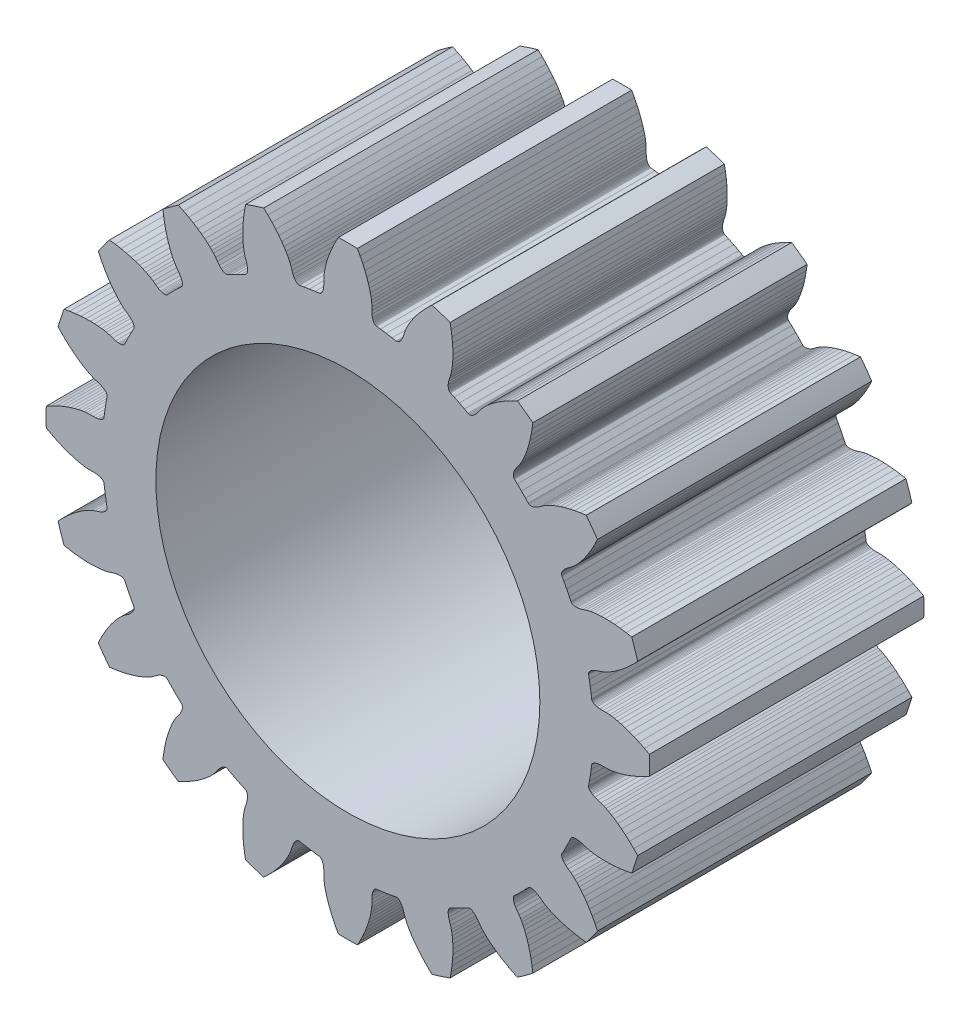
from build123d import *

# Parameters (mm, degrees)
MODEL_R             = 7
BOSS_EXTRUDE1_DEPTH = 10


with BuildPart() as part:
    # Model → Boss-Extrude1 (new body)
    with BuildSketch(Plane.XY):
        with BuildLine():
            Line((10.2642316, 2.7645963), (10.4198698, 2.9157647))
            Line((10.4198698, 2.9157647), (10.563702333, 3.067222802))
            ThreePointArc((10.563702333, 3.067222802), (10.461607226, 3.399182266), (10.349083027, 3.727753112))
            Line((10.349083027, 3.727753112), (10.1436952, 3.7657426))
            Line((10.1436952, 3.7657426), (9.9289267, 3.7965585))
            Line((9.9289267, 3.7965585), (9.7306982, 3.8165653))
            Line((9.7306982, 3.8165653), (9.5477946, 3.8273548))
            Line((9.5477946, 3.8273548), (9.3796606, 3.8301929))
            Line((9.3796606, 3.8301929), (9.2296358, 3.8264332))
            Line((9.2296358, 3.8264332), (9.0951517, 3.8174159))
            Line((9.0951517, 3.8174159), (8.9794383, 3.8047754))
            Line((8.9794383, 3.8047754), (8.8801295, 3.7897415))
            Line((8.8801295, 3.7897415), (8.7979029, 3.7737819))
            Line((8.7979029, 3.7737819), (8.6805247, 3.7436154))
            Line((8.6805247, 3.7436154), (8.5689891, 3.7043833))
            Line((8.5689891, 3.7043833), (8.461599, 3.6746146))
            Line((8.461599, 3.6746146), (8.3671904, 3.6597655))
            Line((8.3671904, 3.6597655), (8.3251901, 3.6575683))
            Line((8.3251901, 3.6575683), (8.2868098, 3.6586634))
            Line((8.2868098, 3.6586634), (8.2521847, 3.6628951))
            Line((8.2521847, 3.6628951), (8.2214235, 3.6700945))
            Line((8.2214235, 3.6700945), (8.1946211, 3.6801191))
            Line((8.1946211, 3.6801191), (8.1718908, 3.6927909))
            Line((8.1718908, 3.6927909), (8.1533277, 3.7079451))
            Line((8.1533277, 3.7079451), (8.1390269, 3.725417))
            Line((8.1390269, 3.725417), (8.1311438, 3.7399412))
            Line((8.1311438, 3.7399412), (8.0678585, 3.8746306))
            Line((8.0678585, 3.8746306), (7.9745084, 4.063215))
            Line((7.9745084, 4.063215), (7.8768102, 4.2495839))
            Line((7.8768102, 4.2495839), (7.8050425, 4.3799512))
            Line((7.8050425, 4.3799512), (7.7979257, 4.3948659))
            Line((7.7979257, 4.3948659), (7.7921964, 4.4167052))
            Line((7.7921964, 4.4167052), (7.7908475, 4.4406305))
            Line((7.7908475, 4.4406305), (7.7939563, 4.466468))
            Line((7.7939563, 4.466468), (7.8016003, 4.4940439))
            Line((7.8016003, 4.4940439), (7.8138569, 4.5231619))
            Line((7.8138569, 4.5231619), (7.8307854, 4.5536616))
            Line((7.8307854, 4.5536616), (7.8524589, 4.5853556))
            Line((7.8524589, 4.5853556), (7.8789236, 4.618043))
            Line((7.8789236, 4.618043), (7.9464287, 4.6856931))
            Line((7.9464287, 4.6856931), (8.0336344, 4.755076))
            Line((8.0336344, 4.755076), (8.1309329, 4.8222501))
            Line((8.1309329, 4.8222501), (8.2243313, 4.8994796))
            Line((8.2243313, 4.8994796), (8.2855745, 4.9566215))
            Line((8.2855745, 4.9566215), (8.3561094, 5.0281273))
            Line((8.3561094, 5.0281273), (8.4343503, 5.1143115))
            Line((8.4343503, 5.1143115), (8.5206933, 5.2178112))
            Line((8.5206933, 5.2178112), (8.6119173, 5.336974))
            Line((8.6119173, 5.336974), (8.7084479, 5.4746654))
            Line((8.7084479, 5.4746654), (8.8072271, 5.6289795))
            Line((8.8072271, 5.6289795), (8.9075571, 5.8011094))
            Line((8.9075571, 5.8011094), (9.0088642, 5.9929738))
            Line((9.0088642, 5.9929738), (9.098854025, 6.181465815))
            ThreePointArc((9.098854025, 6.181465815), (8.899174807, 6.465628975), (8.690623821, 6.743346417))
            Line((8.690623821, 6.743346417), (8.483549, 6.7160083))
            Line((8.483549, 6.7160083), (8.2697694, 6.6789488))
            Line((8.2697694, 6.6789488), (8.0750604, 6.6367204))
            Line((8.0750604, 6.6367204), (7.8977746, 6.5904615))
            Line((7.8977746, 6.5904615), (7.7369927, 6.5412044))
            Line((7.7369927, 6.5412044), (7.5954723, 6.4912685))
            Line((7.5954723, 6.4912685), (7.4703569, 6.4411347))
            Line((7.4703569, 6.4411347), (7.3642131, 6.3933555))
            Line((7.3642131, 6.3933555), (7.2744105, 6.3483693))
            Line((7.2744105, 6.3483693), (7.2011401, 6.3077814))
            Line((7.2011401, 6.3077814), (7.0988288, 6.2428195))
            Line((7.0988288, 6.2428195), (7.0048755, 6.1710411))
            Line((7.0048755, 6.1710411), (6.9119405, 6.109544))
            Line((6.9119405, 6.109544), (6.8267412, 6.0662479))
            Line((6.8267412, 6.0662479), (6.7874756, 6.0511794))
            Line((6.7874756, 6.0511794), (6.7506353, 6.0403607))
            Line((6.7506353, 6.0403607), (6.7163972, 6.0336856))
            Line((6.7163972, 6.0336856), (6.6849168, 6.0310269))
            Line((6.6849168, 6.0310269), (6.6563285, 6.0322785))
            Line((6.6563285, 6.0322785), (6.6307948, 6.037306))
            Line((6.6307948, 6.037306), (6.6084573, 6.0459822))
            Line((6.6084573, 6.0459822), (6.5894574, 6.0581798))
            Line((6.5894574, 6.0581798), (6.5774719, 6.0695571))
            Line((6.5774719, 6.0695571), (6.4756627, 6.178098))
            Line((6.4756627, 6.178098), (6.3286057, 6.3286057))
            Line((6.3286057, 6.3286057), (6.178098, 6.4756627))
            Line((6.178098, 6.4756627), (6.0695571, 6.5774719))
            Line((6.0695571, 6.5774719), (6.0581798, 6.5894574))
            Line((6.0581798, 6.5894574), (6.0459822, 6.6084573))
            Line((6.0459822, 6.6084573), (6.037306, 6.6307948))
            Line((6.037306, 6.6307948), (6.0322785, 6.6563285))
            Line((6.0322785, 6.6563285), (6.0310269, 6.6849168))
            Line((6.0310269, 6.6849168), (6.0336856, 6.7163972))
            Line((6.0336856, 6.7163972), (6.0403607, 6.7506353))
            Line((6.0403607, 6.7506353), (6.0511794, 6.7874756))
            Line((6.0511794, 6.7874756), (6.0662479, 6.8267412))
            Line((6.0662479, 6.8267412), (6.109544, 6.9119405))
            Line((6.109544, 6.9119405), (6.1710411, 7.0048755))
            Line((6.1710411, 7.0048755), (6.2428195, 7.0988288))
            Line((6.2428195, 7.0988288), (6.3077814, 7.2011401))
            Line((6.3077814, 7.2011401), (6.3483693, 7.2744105))
            Line((6.3483693, 7.2744105), (6.3933555, 7.3642131))
            Line((6.3933555, 7.3642131), (6.4411347, 7.4703569))
            Line((6.4411347, 7.4703569), (6.4912685, 7.5954723))
            Line((6.4912685, 7.5954723), (6.5412044, 7.7369927))
            Line((6.5412044, 7.7369927), (6.5904615, 7.8977746))
            Line((6.5904615, 7.8977746), (6.6367204, 8.0750604))
            Line((6.6367204, 8.0750604), (6.6789488, 8.2697694))
            Line((6.6789488, 8.2697694), (6.7160083, 8.483549))
            Line((6.7160083, 8.483549), (6.743346317, 8.690623821))
            ThreePointArc((6.743346317, 8.690623821), (6.465628515, 8.899174311), (6.181465715, 9.098854025))
            Line((6.181465715, 9.098854025), (5.9929738, 9.0088642))
            Line((5.9929738, 9.0088642), (5.8011094, 8.9075571))
            Line((5.8011094, 8.9075571), (5.6289795, 8.8072271))
            Line((5.6289795, 8.8072271), (5.4746654, 8.7084479))
            Line((5.4746654, 8.7084479), (5.336974, 8.6119173))
            Line((5.336974, 8.6119173), (5.2178112, 8.5206933))
            Line((5.2178112, 8.5206933), (5.1143115, 8.4343503))
            Line((5.1143115, 8.4343503), (5.0281273, 8.3561094))
            Line((5.0281273, 8.3561094), (4.9566215, 8.2855745))
            Line((4.9566215, 8.2855745), (4.8994796, 8.2243313))
            Line((4.8994796, 8.2243313), (4.8222501, 8.1309329))
            Line((4.8222501, 8.1309329), (4.755076, 8.0336344))
            Line((4.755076, 8.0336344), (4.6856931, 7.9464287))
            Line((4.6856931, 7.9464287), (4.618043, 7.8789236))
            Line((4.618043, 7.8789236), (4.5853556, 7.8524589))
            Line((4.5853556, 7.8524589), (4.5536616, 7.8307854))
            Line((4.5536616, 7.8307854), (4.5231619, 7.8138569))
            Line((4.5231619, 7.8138569), (4.4940439, 7.8016003))
            Line((4.4940439, 7.8016003), (4.466468, 7.7939563))
            Line((4.466468, 7.7939563), (4.4406305, 7.7908475))
            Line((4.4406305, 7.7908475), (4.4167052, 7.7921964))
            Line((4.4167052, 7.7921964), (4.3948659, 7.7979257))
            Line((4.3948659, 7.7979257), (4.3799512, 7.8050425))
            Line((4.3799512, 7.8050425), (4.2495839, 7.8768102))
            Line((4.2495839, 7.8768102), (4.063215, 7.9745084))
            Line((4.063215, 7.9745084), (3.8746306, 8.0678585))
            Line((3.8746306, 8.0678585), (3.7399412, 8.1311438))
            Line((3.7399412, 8.1311438), (3.725417, 8.1390269))
            Line((3.725417, 8.1390269), (3.7079451, 8.1533277))
            Line((3.7079451, 8.1533277), (3.6927909, 8.1718908))
            Line((3.6927909, 8.1718908), (3.6801191, 8.1946211))
            Line((3.6801191, 8.1946211), (3.6700945, 8.2214235))
            Line((3.6700945, 8.2214235), (3.6628951, 8.2521847))
            Line((3.6628951, 8.2521847), (3.6586634, 8.2868098))
            Line((3.6586634, 8.2868098), (3.6575683, 8.3251901))
            Line((3.6575683, 8.3251901), (3.6597655, 8.3671904))
            Line((3.6597655, 8.3671904), (3.6746146, 8.461599))
            Line((3.6746146, 8.461599), (3.7043833, 8.5689891))
            Line((3.7043833, 8.5689891), (3.7436154, 8.6805247))
            Line((3.7436154, 8.6805247), (3.7737819, 8.7979029))
            Line((3.7737819, 8.7979029), (3.7897415, 8.8801295))
            Line((3.7897415, 8.8801295), (3.8047754, 8.9794383))
            Line((3.8047754, 8.9794383), (3.8174159, 9.0951517))
            Line((3.8174159, 9.0951517), (3.8264332, 9.2296358))
            Line((3.8264332, 9.2296358), (3.8301929, 9.3796606))
            Line((3.8301929, 9.3796606), (3.8273548, 9.5477946))
            Line((3.8273548, 9.5477946), (3.8165653, 9.7306982))
            Line((3.8165653, 9.7306982), (3.7965585, 9.9289267))
            Line((3.7965585, 9.9289267), (3.7657426, 10.1436952))
            Line((3.7657426, 10.1436952), (3.727753086, 10.349082973))
            ThreePointArc((3.727753086, 10.349082973), (3.399182156, 10.461606884), (3.067222791, 10.563702266))
            Line((3.067222791, 10.563702266), (2.9157647, 10.4198698))
            Line((2.9157647, 10.4198698), (2.7645963, 10.2642316))
            Line((2.7645963, 10.2642316), (2.6318948, 10.115621))
            Line((2.6318948, 10.115621), (2.5156578, 9.9739908))
            Line((2.5156578, 9.9739908), (2.4145351, 9.8396357))
            Line((2.4145351, 9.8396357), (2.3293943, 9.7160532))
            Line((2.3293943, 9.7160532), (2.2576417, 9.601953))
            Line((2.2576417, 9.601953), (2.1998535, 9.5009091))
            Line((2.1998535, 9.5009091), (2.1536439, 9.4117299))
            Line((2.1536439, 9.4117299), (2.1182238, 9.3358263))
            Line((2.1182238, 9.3358263), (2.0736359, 9.223134))
            Line((2.0736359, 9.223134), (2.0398164, 9.1098397))
            Line((2.0398164, 9.1098397), (2.0007775, 9.0054616))
            Line((2.0007775, 9.0054616), (1.9572986, 8.9203554))
            Line((1.9572986, 8.9203554), (1.9343891, 8.885085))
            Line((1.9343891, 8.885085), (1.9109438, 8.8546783))
            Line((1.9109438, 8.8546783), (1.8871681, 8.8291534))
            Line((1.8871681, 8.8291534), (1.8632626, 8.8084987))
            Line((1.8632626, 8.8084987), (1.8393985, 8.7927075))
            Line((1.8393985, 8.7927075), (1.8157863, 8.7817666))
            Line((1.8157863, 8.7817666), (1.7926151, 8.7756561))
            Line((1.7926151, 8.7756561), (1.7700743, 8.7743563))
            Line((1.7700743, 8.7743563), (1.7536904, 8.7765159))
            Line((1.7536904, 8.7765159), (1.6075263, 8.8044853))
            Line((1.6075263, 8.8044853), (1.4000885, 8.8398106))
            Line((1.4000885, 8.8398106), (1.1918873, 8.8703161))
            Line((1.1918873, 8.8703161), (1.0442339, 8.8888827))
            Line((1.0442339, 8.8888827), (1.0279845, 8.8918917))
            Line((1.0279845, 8.8918917), (1.0069486, 8.9000935))
            Line((1.0069486, 8.9000935), (0.9867997, 8.9130651))
            Line((0.9867997, 8.9130651), (0.9677241, 8.9307672))
            Line((0.9677241, 8.9307672), (0.9499077, 8.9531599))
            Line((0.9499077, 8.9531599), (0.933555, 8.9801909))
            Line((0.933555, 8.9801909), (0.9188306, 9.0118136))
            Line((0.9188306, 9.0118136), (0.9059289, 9.0479771))
            Line((0.9059289, 9.0479771), (0.8950398, 9.0886007))
            Line((0.8950398, 9.0886007), (0.8799882, 9.1829772))
            Line((0.8799882, 9.1829772), (0.8751146, 9.2943103))
            Line((0.8751146, 9.2943103), (0.8779602, 9.4125104))
            Line((0.8779602, 9.4125104), (0.8703784, 9.5334656))
            Line((0.8703784, 9.5334656), (0.8601475, 9.6165996))
            Line((0.8601475, 9.6165996), (0.8437574, 9.7156936))
            Line((0.8437574, 9.7156936), (0.8200218, 9.8296496))
            Line((0.8200218, 9.8296496), (0.7870399, 9.9603381))
            Line((0.7870399, 9.9603381), (0.7442553, 10.1041821))
            Line((0.7442553, 10.1041821), (0.6895999, 10.26321))
            Line((0.6895999, 10.26321), (0.6228181, 10.4338275))
            Line((0.6228181, 10.4338275), (0.5425346, 10.6161716))
            Line((0.5425346, 10.6161716), (0.4468599, 10.8109059))
            Line((0.4468599, 10.8109059), (0.347261396, 10.994501951))
            ThreePointArc((0.347261396, 10.994501951), (4.2e-08, 10.9999847), (-0.347261311, 10.994501948))
            Line((-0.347261311, 10.994501948), (-0.4468599, 10.8109059))
            Line((-0.4468599, 10.8109059), (-0.5425346, 10.6161716))
            Line((-0.5425346, 10.6161716), (-0.6228181, 10.4338275))
            Line((-0.6228181, 10.4338275), (-0.6895999, 10.26321))
            Line((-0.6895999, 10.26321), (-0.7442553, 10.1041821))
            Line((-0.7442553, 10.1041821), (-0.7870399, 9.9603381))
            Line((-0.7870399, 9.9603381), (-0.8200218, 9.8296496))
            Line((-0.8200218, 9.8296496), (-0.8437574, 9.7156936))
            Line((-0.8437574, 9.7156936), (-0.8601475, 9.6165996))
            Line((-0.8601475, 9.6165996), (-0.8703784, 9.5334656))
            Line((-0.8703784, 9.5334656), (-0.8779602, 9.4125104))
            Line((-0.8779602, 9.4125104), (-0.8751146, 9.2943103))
            Line((-0.8751146, 9.2943103), (-0.8799882, 9.1829772))
            Line((-0.8799882, 9.1829772), (-0.8950398, 9.0886007))
            Line((-0.8950398, 9.0886007), (-0.9059289, 9.0479771))
            Line((-0.9059289, 9.0479771), (-0.9188306, 9.0118136))
            Line((-0.9188306, 9.0118136), (-0.933555, 8.9801909))
            Line((-0.933555, 8.9801909), (-0.9499077, 8.9531599))
            Line((-0.9499077, 8.9531599), (-0.9677241, 8.9307672))
            Line((-0.9677241, 8.9307672), (-0.9867997, 8.9130651))
            Line((-0.9867997, 8.9130651), (-1.0069486, 8.9000935))
            Line((-1.0069486, 8.9000935), (-1.0279845, 8.8918917))
            Line((-1.0279845, 8.8918917), (-1.0442339, 8.8888827))
            Line((-1.0442339, 8.8888827), (-1.1918873, 8.8703161))
            Line((-1.1918873, 8.8703161), (-1.4000885, 8.8398106))
            Line((-1.4000885, 8.8398106), (-1.6075263, 8.8044853))
            Line((-1.6075263, 8.8044853), (-1.7536904, 8.7765159))
            Line((-1.7536904, 8.7765159), (-1.7700743, 8.7743563))
            Line((-1.7700743, 8.7743563), (-1.7926151, 8.7756561))
            Line((-1.7926151, 8.7756561), (-1.8157863, 8.7817666))
            Line((-1.8157863, 8.7817666), (-1.8393985, 8.7927075))
            Line((-1.8393985, 8.7927075), (-1.8632626, 8.8084987))
            Line((-1.8632626, 8.8084987), (-1.8871681, 8.8291534))
            Line((-1.8871681, 8.8291534), (-1.9109438, 8.8546783))
            Line((-1.9109438, 8.8546783), (-1.9343891, 8.885085))
            Line((-1.9343891, 8.885085), (-1.9572986, 8.9203554))
            Line((-1.9572986, 8.9203554), (-2.0007775, 9.0054616))
            Line((-2.0007775, 9.0054616), (-2.0398164, 9.1098397))
            Line((-2.0398164, 9.1098397), (-2.0736359, 9.223134))
            Line((-2.0736359, 9.223134), (-2.1182238, 9.3358263))
            Line((-2.1182238, 9.3358263), (-2.1536439, 9.4117299))
            Line((-2.1536439, 9.4117299), (-2.1998535, 9.5009091))
            Line((-2.1998535, 9.5009091), (-2.2576417, 9.601953))
            Line((-2.2576417, 9.601953), (-2.3293943, 9.7160532))
            Line((-2.3293943, 9.7160532), (-2.4145351, 9.8396357))
            Line((-2.4145351, 9.8396357), (-2.5156578, 9.9739908))
            Line((-2.5156578, 9.9739908), (-2.6318948, 10.115621))
            Line((-2.6318948, 10.115621), (-2.7645963, 10.2642316))
            Line((-2.7645963, 10.2642316), (-2.9157647, 10.4198698))
            Line((-2.9157647, 10.4198698), (-3.067222802, 10.563702333))
            ThreePointArc((-3.067222802, 10.563702333), (-3.399182137, 10.461606832), (-3.727753112, 10.349083027))
            Line((-3.727753112, 10.349083027), (-3.7657426, 10.1436952))
            Line((-3.7657426, 10.1436952), (-3.7965585, 9.9289267))
            Line((-3.7965585, 9.9289267), (-3.8165653, 9.7306982))
            Line((-3.8165653, 9.7306982), (-3.8273548, 9.5477946))
            Line((-3.8273548, 9.5477946), (-3.8301929, 9.3796606))
            Line((-3.8301929, 9.3796606), (-3.8264332, 9.2296358))
            Line((-3.8264332, 9.2296358), (-3.8174159, 9.0951517))
            Line((-3.8174159, 9.0951517), (-3.8047754, 8.9794383))
            Line((-3.8047754, 8.9794383), (-3.7897415, 8.8801295))
            Line((-3.7897415, 8.8801295), (-3.7737819, 8.7979029))
            Line((-3.7737819, 8.7979029), (-3.7436154, 8.6805247))
            Line((-3.7436154, 8.6805247), (-3.7043833, 8.5689891))
            Line((-3.7043833, 8.5689891), (-3.6746146, 8.461599))
            Line((-3.6746146, 8.461599), (-3.6597655, 8.3671904))
            Line((-3.6597655, 8.3671904), (-3.6575683, 8.3251901))
            Line((-3.6575683, 8.3251901), (-3.6586634, 8.2868098))
            Line((-3.6586634, 8.2868098), (-3.6628951, 8.2521847))
            Line((-3.6628951, 8.2521847), (-3.6700945, 8.2214235))
            Line((-3.6700945, 8.2214235), (-3.6801191, 8.1946211))
            Line((-3.6801191, 8.1946211), (-3.6927909, 8.1718908))
            Line((-3.6927909, 8.1718908), (-3.7079451, 8.1533277))
            Line((-3.7079451, 8.1533277), (-3.725417, 8.1390269))
            Line((-3.725417, 8.1390269), (-3.7399412, 8.1311438))
            Line((-3.7399412, 8.1311438), (-3.8746306, 8.0678585))
            Line((-3.8746306, 8.0678585), (-4.063215, 7.9745084))
            Line((-4.063215, 7.9745084), (-4.2495839, 7.8768102))
            Line((-4.2495839, 7.8768102), (-4.3799512, 7.8050425))
            Line((-4.3799512, 7.8050425), (-4.3948659, 7.7979257))
            Line((-4.3948659, 7.7979257), (-4.4167052, 7.7921964))
            Line((-4.4167052, 7.7921964), (-4.4406305, 7.7908475))
            Line((-4.4406305, 7.7908475), (-4.466468, 7.7939563))
            Line((-4.466468, 7.7939563), (-4.4940439, 7.8016003))
            Line((-4.4940439, 7.8016003), (-4.5231619, 7.8138569))
            Line((-4.5231619, 7.8138569), (-4.5536616, 7.8307854))
            Line((-4.5536616, 7.8307854), (-4.5853556, 7.8524589))
            Line((-4.5853556, 7.8524589), (-4.618043, 7.8789236))
            Line((-4.618043, 7.8789236), (-4.6856931, 7.9464287))
            Line((-4.6856931, 7.9464287), (-4.755076, 8.0336344))
            Line((-4.755076, 8.0336344), (-4.8222501, 8.1309329))
            Line((-4.8222501, 8.1309329), (-4.8994796, 8.2243313))
            Line((-4.8994796, 8.2243313), (-4.9566215, 8.2855745))
            Line((-4.9566215, 8.2855745), (-5.0281273, 8.3561094))
            Line((-5.0281273, 8.3561094), (-5.1143115, 8.4343503))
            Line((-5.1143115, 8.4343503), (-5.2178112, 8.5206933))
            Line((-5.2178112, 8.5206933), (-5.336974, 8.6119173))
            Line((-5.336974, 8.6119173), (-5.4746654, 8.7084479))
            Line((-5.4746654, 8.7084479), (-5.6289795, 8.8072271))
            Line((-5.6289795, 8.8072271), (-5.8011094, 8.9075571))
            Line((-5.8011094, 8.9075571), (-5.9929738, 9.0088642))
            Line((-5.9929738, 9.0088642), (-6.181465815, 9.098854025))
            ThreePointArc((-6.181465815, 9.098854025), (-6.465628732, 8.899174473), (-6.743346417, 8.690623821))
            Line((-6.743346417, 8.690623821), (-6.7160083, 8.483549))
            Line((-6.7160083, 8.483549), (-6.6789488, 8.2697694))
            Line((-6.6789488, 8.2697694), (-6.6367204, 8.0750604))
            Line((-6.6367204, 8.0750604), (-6.5904615, 7.8977746))
            Line((-6.5904615, 7.8977746), (-6.5412044, 7.7369927))
            Line((-6.5412044, 7.7369927), (-6.4912685, 7.5954723))
            Line((-6.4912685, 7.5954723), (-6.4411347, 7.4703569))
            Line((-6.4411347, 7.4703569), (-6.3933555, 7.3642131))
            Line((-6.3933555, 7.3642131), (-6.3483693, 7.2744105))
            Line((-6.3483693, 7.2744105), (-6.3077814, 7.2011401))
            Line((-6.3077814, 7.2011401), (-6.2428195, 7.0988288))
            Line((-6.2428195, 7.0988288), (-6.1710411, 7.0048755))
            Line((-6.1710411, 7.0048755), (-6.109544, 6.9119405))
            Line((-6.109544, 6.9119405), (-6.0662479, 6.8267412))
            Line((-6.0662479, 6.8267412), (-6.0511794, 6.7874756))
            Line((-6.0511794, 6.7874756), (-6.0403607, 6.7506353))
            Line((-6.0403607, 6.7506353), (-6.0336856, 6.7163972))
            Line((-6.0336856, 6.7163972), (-6.0310269, 6.6849168))
            Line((-6.0310269, 6.6849168), (-6.0322785, 6.6563285))
            Line((-6.0322785, 6.6563285), (-6.037306, 6.6307948))
            Line((-6.037306, 6.6307948), (-6.0459822, 6.6084573))
            Line((-6.0459822, 6.6084573), (-6.0581798, 6.5894574))
            Line((-6.0581798, 6.5894574), (-6.0695571, 6.5774719))
            Line((-6.0695571, 6.5774719), (-6.178098, 6.4756627))
            Line((-6.178098, 6.4756627), (-6.3286057, 6.3286057))
            Line((-6.3286057, 6.3286057), (-6.4756627, 6.178098))
            Line((-6.4756627, 6.178098), (-6.5774719, 6.0695571))
            Line((-6.5774719, 6.0695571), (-6.5894574, 6.0581798))
            Line((-6.5894574, 6.0581798), (-6.6084573, 6.0459822))
            Line((-6.6084573, 6.0459822), (-6.6307948, 6.037306))
            Line((-6.6307948, 6.037306), (-6.6563285, 6.0322785))
            Line((-6.6563285, 6.0322785), (-6.6849168, 6.0310269))
            Line((-6.6849168, 6.0310269), (-6.7163972, 6.0336856))
            Line((-6.7163972, 6.0336856), (-6.7506353, 6.0403607))
            Line((-6.7506353, 6.0403607), (-6.7874756, 6.0511794))
            Line((-6.7874756, 6.0511794), (-6.8267412, 6.0662479))
            Line((-6.8267412, 6.0662479), (-6.9119405, 6.109544))
            Line((-6.9119405, 6.109544), (-7.0048755, 6.1710411))
            Line((-7.0048755, 6.1710411), (-7.0988288, 6.2428195))
            Line((-7.0988288, 6.2428195), (-7.2011401, 6.3077814))
            Line((-7.2011401, 6.3077814), (-7.2744105, 6.3483693))
            Line((-7.2744105, 6.3483693), (-7.3642131, 6.3933555))
            Line((-7.3642131, 6.3933555), (-7.4703569, 6.4411347))
            Line((-7.4703569, 6.4411347), (-7.5954723, 6.4912685))
            Line((-7.5954723, 6.4912685), (-7.7369927, 6.5412044))
            Line((-7.7369927, 6.5412044), (-7.8977746, 6.5904615))
            Line((-7.8977746, 6.5904615), (-8.0750604, 6.6367204))
            Line((-8.0750604, 6.6367204), (-8.2697694, 6.6789488))
            Line((-8.2697694, 6.6789488), (-8.483549, 6.7160083))
            Line((-8.483549, 6.7160083), (-8.690623821, 6.743346317))
            ThreePointArc((-8.690623821, 6.743346317), (-8.89917456, 6.465628696), (-9.098854025, 6.181465715))
            Line((-9.098854025, 6.181465715), (-9.0088642, 5.9929738))
            Line((-9.0088642, 5.9929738), (-8.9075571, 5.8011094))
            Line((-8.9075571, 5.8011094), (-8.8072271, 5.6289795))
            Line((-8.8072271, 5.6289795), (-8.7084479, 5.4746654))
            Line((-8.7084479, 5.4746654), (-8.6119173, 5.336974))
            Line((-8.6119173, 5.336974), (-8.5206933, 5.2178112))
            Line((-8.5206933, 5.2178112), (-8.4343503, 5.1143115))
            Line((-8.4343503, 5.1143115), (-8.3561094, 5.0281273))
            Line((-8.3561094, 5.0281273), (-8.2855745, 4.9566215))
            Line((-8.2855745, 4.9566215), (-8.2243313, 4.8994796))
            Line((-8.2243313, 4.8994796), (-8.1309329, 4.8222501))
            Line((-8.1309329, 4.8222501), (-8.0336344, 4.755076))
            Line((-8.0336344, 4.755076), (-7.9464287, 4.6856931))
            Line((-7.9464287, 4.6856931), (-7.8789236, 4.618043))
            Line((-7.8789236, 4.618043), (-7.8524589, 4.5853556))
            Line((-7.8524589, 4.5853556), (-7.8307854, 4.5536616))
            Line((-7.8307854, 4.5536616), (-7.8138569, 4.5231619))
            Line((-7.8138569, 4.5231619), (-7.8016003, 4.4940439))
            Line((-7.8016003, 4.4940439), (-7.7939563, 4.466468))
            Line((-7.7939563, 4.466468), (-7.7908475, 4.4406305))
            Line((-7.7908475, 4.4406305), (-7.7921964, 4.4167052))
            Line((-7.7921964, 4.4167052), (-7.7979257, 4.3948659))
            Line((-7.7979257, 4.3948659), (-7.8050425, 4.3799512))
            Line((-7.8050425, 4.3799512), (-7.8768102, 4.2495839))
            Line((-7.8768102, 4.2495839), (-7.9745084, 4.063215))
            Line((-7.9745084, 4.063215), (-8.0678585, 3.8746306))
            Line((-8.0678585, 3.8746306), (-8.1311438, 3.7399412))
            Line((-8.1311438, 3.7399412), (-8.1390269, 3.725417))
            Line((-8.1390269, 3.725417), (-8.1533277, 3.7079451))
            Line((-8.1533277, 3.7079451), (-8.1718908, 3.6927909))
            Line((-8.1718908, 3.6927909), (-8.1946211, 3.6801191))
            Line((-8.1946211, 3.6801191), (-8.2214235, 3.6700945))
            Line((-8.2214235, 3.6700945), (-8.2521847, 3.6628951))
            Line((-8.2521847, 3.6628951), (-8.2868098, 3.6586634))
            Line((-8.2868098, 3.6586634), (-8.3251901, 3.6575683))
            Line((-8.3251901, 3.6575683), (-8.3671904, 3.6597655))
            Line((-8.3671904, 3.6597655), (-8.461599, 3.6746146))
            Line((-8.461599, 3.6746146), (-8.5689891, 3.7043833))
            Line((-8.5689891, 3.7043833), (-8.6805247, 3.7436154))
            Line((-8.6805247, 3.7436154), (-8.7979029, 3.7737819))
            Line((-8.7979029, 3.7737819), (-8.8801295, 3.7897415))
            Line((-8.8801295, 3.7897415), (-8.9794383, 3.8047754))
            Line((-8.9794383, 3.8047754), (-9.0951517, 3.8174159))
            Line((-9.0951517, 3.8174159), (-9.2296358, 3.8264332))
            Line((-9.2296358, 3.8264332), (-9.3796606, 3.8301929))
            Line((-9.3796606, 3.8301929), (-9.5477946, 3.8273548))
            Line((-9.5477946, 3.8273548), (-9.7306982, 3.8165653))
            Line((-9.7306982, 3.8165653), (-9.9289267, 3.7965585))
            Line((-9.9289267, 3.7965585), (-10.1436952, 3.7657426))
            Line((-10.1436952, 3.7657426), (-10.349082973, 3.727753086))
            ThreePointArc((-10.349082973, 3.727753086), (-10.461606761, 3.399182116), (-10.563702266, 3.067222791))
            Line((-10.563702266, 3.067222791), (-10.4198698, 2.9157647))
            Line((-10.4198698, 2.9157647), (-10.2642316, 2.7645963))
            Line((-10.2642316, 2.7645963), (-10.115621, 2.6318948))
            Line((-10.115621, 2.6318948), (-9.9739908, 2.5156578))
            Line((-9.9739908, 2.5156578), (-9.8396357, 2.4145351))
            Line((-9.8396357, 2.4145351), (-9.7160532, 2.3293943))
            Line((-9.7160532, 2.3293943), (-9.601953, 2.2576417))
            Line((-9.601953, 2.2576417), (-9.5009091, 2.1998535))
            Line((-9.5009091, 2.1998535), (-9.4117299, 2.1536439))
            Line((-9.4117299, 2.1536439), (-9.3358263, 2.1182238))
            Line((-9.3358263, 2.1182238), (-9.223134, 2.0736359))
            Line((-9.223134, 2.0736359), (-9.1098397, 2.0398164))
            Line((-9.1098397, 2.0398164), (-9.0054616, 2.0007775))
            Line((-9.0054616, 2.0007775), (-8.9203554, 1.9572986))
            Line((-8.9203554, 1.9572986), (-8.885085, 1.9343891))
            Line((-8.885085, 1.9343891), (-8.8546783, 1.9109438))
            Line((-8.8546783, 1.9109438), (-8.8291534, 1.8871681))
            Line((-8.8291534, 1.8871681), (-8.8084987, 1.8632626))
            Line((-8.8084987, 1.8632626), (-8.7927075, 1.8393985))
            Line((-8.7927075, 1.8393985), (-8.7817666, 1.8157863))
            Line((-8.7817666, 1.8157863), (-8.7756561, 1.7926151))
            Line((-8.7756561, 1.7926151), (-8.7743563, 1.7700743))
            Line((-8.7743563, 1.7700743), (-8.7765159, 1.7536904))
            Line((-8.7765159, 1.7536904), (-8.8044853, 1.6075263))
            Line((-8.8044853, 1.6075263), (-8.8398106, 1.4000885))
            Line((-8.8398106, 1.4000885), (-8.8703161, 1.1918873))
            Line((-8.8703161, 1.1918873), (-8.8888827, 1.0442339))
            Line((-8.8888827, 1.0442339), (-8.8918917, 1.0279845))
            Line((-8.8918917, 1.0279845), (-8.9000935, 1.0069486))
            Line((-8.9000935, 1.0069486), (-8.9130651, 0.9867997))
            Line((-8.9130651, 0.9867997), (-8.9307672, 0.9677241))
            Line((-8.9307672, 0.9677241), (-8.9531599, 0.9499077))
            Line((-8.9531599, 0.9499077), (-8.9801909, 0.933555))
            Line((-8.9801909, 0.933555), (-9.0118136, 0.9188306))
            Line((-9.0118136, 0.9188306), (-9.0479771, 0.9059289))
            Line((-9.0479771, 0.9059289), (-9.0886007, 0.8950398))
            Line((-9.0886007, 0.8950398), (-9.1829772, 0.8799882))
            Line((-9.1829772, 0.8799882), (-9.2943103, 0.8751146))
            Line((-9.2943103, 0.8751146), (-9.4125104, 0.8779602))
            Line((-9.4125104, 0.8779602), (-9.5334656, 0.8703784))
            Line((-9.5334656, 0.8703784), (-9.6165996, 0.8601475))
            Line((-9.6165996, 0.8601475), (-9.7156936, 0.8437574))
            Line((-9.7156936, 0.8437574), (-9.8296496, 0.8200218))
            Line((-9.8296496, 0.8200218), (-9.9603381, 0.7870399))
            Line((-9.9603381, 0.7870399), (-10.1041821, 0.7442553))
            Line((-10.1041821, 0.7442553), (-10.26321, 0.6895999))
            Line((-10.26321, 0.6895999), (-10.4338275, 0.6228181))
            Line((-10.4338275, 0.6228181), (-10.6161716, 0.5425346))
            Line((-10.6161716, 0.5425346), (-10.8109059, 0.4468599))
            Line((-10.8109059, 0.4468599), (-10.994501948, 0.347261411))
            ThreePointArc((-10.994501948, 0.347261411), (-10.999984552, 5.8e-08), (-10.994501951, -0.347261296))
            Line((-10.994501951, -0.347261296), (-10.8109059, -0.4468599))
            Line((-10.8109059, -0.4468599), (-10.6161716, -0.5425346))
            Line((-10.6161716, -0.5425346), (-10.4338275, -0.6228181))
            Line((-10.4338275, -0.6228181), (-10.26321, -0.6895999))
            Line((-10.26321, -0.6895999), (-10.1041821, -0.7442553))
            Line((-10.1041821, -0.7442553), (-9.9603381, -0.7870399))
            Line((-9.9603381, -0.7870399), (-9.8296496, -0.8200218))
            Line((-9.8296496, -0.8200218), (-9.7156936, -0.8437574))
            Line((-9.7156936, -0.8437574), (-9.6165996, -0.8601475))
            Line((-9.6165996, -0.8601475), (-9.5334656, -0.8703784))
            Line((-9.5334656, -0.8703784), (-9.4125104, -0.8779602))
            Line((-9.4125104, -0.8779602), (-9.2943103, -0.8751146))
            Line((-9.2943103, -0.8751146), (-9.1829772, -0.8799882))
            Line((-9.1829772, -0.8799882), (-9.0886007, -0.8950398))
            Line((-9.0886007, -0.8950398), (-9.0479771, -0.9059289))
            Line((-9.0479771, -0.9059289), (-9.0118136, -0.9188306))
            Line((-9.0118136, -0.9188306), (-8.9801909, -0.933555))
            Line((-8.9801909, -0.933555), (-8.9531599, -0.9499077))
            Line((-8.9531599, -0.9499077), (-8.9307672, -0.9677241))
            Line((-8.9307672, -0.9677241), (-8.9130651, -0.9867997))
            Line((-8.9130651, -0.9867997), (-8.9000935, -1.0069486))
            Line((-8.9000935, -1.0069486), (-8.8918917, -1.0279845))
            Line((-8.8918917, -1.0279845), (-8.8888827, -1.0442339))
            Line((-8.8888827, -1.0442339), (-8.8703161, -1.1918873))
            Line((-8.8703161, -1.1918873), (-8.8398106, -1.4000885))
            Line((-8.8398106, -1.4000885), (-8.8044853, -1.6075263))
            Line((-8.8044853, -1.6075263), (-8.7765159, -1.7536904))
            Line((-8.7765159, -1.7536904), (-8.7743563, -1.7700743))
            Line((-8.7743563, -1.7700743), (-8.7756561, -1.7926151))
            Line((-8.7756561, -1.7926151), (-8.7817666, -1.8157863))
            Line((-8.7817666, -1.8157863), (-8.7927075, -1.8393985))
            Line((-8.7927075, -1.8393985), (-8.8084987, -1.8632626))
            Line((-8.8084987, -1.8632626), (-8.8291534, -1.8871681))
            Line((-8.8291534, -1.8871681), (-8.8546783, -1.9109438))
            Line((-8.8546783, -1.9109438), (-8.885085, -1.9343891))
            Line((-8.885085, -1.9343891), (-8.9203554, -1.9572986))
            Line((-8.9203554, -1.9572986), (-9.0054616, -2.0007775))
            Line((-9.0054616, -2.0007775), (-9.1098397, -2.0398164))
            Line((-9.1098397, -2.0398164), (-9.223134, -2.0736359))
            Line((-9.223134, -2.0736359), (-9.3358263, -2.1182238))
            Line((-9.3358263, -2.1182238), (-9.4117299, -2.1536439))
            Line((-9.4117299, -2.1536439), (-9.5009091, -2.1998535))
            Line((-9.5009091, -2.1998535), (-9.601953, -2.2576417))
            Line((-9.601953, -2.2576417), (-9.7160532, -2.3293943))
            Line((-9.7160532, -2.3293943), (-9.8396357, -2.4145351))
            Line((-9.8396357, -2.4145351), (-9.9739908, -2.5156578))
            Line((-9.9739908, -2.5156578), (-10.115621, -2.6318948))
            Line((-10.115621, -2.6318948), (-10.2642316, -2.7645963))
            Line((-10.2642316, -2.7645963), (-10.4198698, -2.9157647))
            Line((-10.4198698, -2.9157647), (-10.563702333, -3.067222802))
            ThreePointArc((-10.563702333, -3.067222802), (-10.461607085, -3.39918222), (-10.349083027, -3.727753112))
            Line((-10.349083027, -3.727753112), (-10.1436952, -3.7657426))
            Line((-10.1436952, -3.7657426), (-9.9289267, -3.7965585))
            Line((-9.9289267, -3.7965585), (-9.7306982, -3.8165653))
            Line((-9.7306982, -3.8165653), (-9.5477946, -3.8273548))
            Line((-9.5477946, -3.8273548), (-9.3796606, -3.8301929))
            Line((-9.3796606, -3.8301929), (-9.2296358, -3.8264332))
            Line((-9.2296358, -3.8264332), (-9.0951517, -3.8174159))
            Line((-9.0951517, -3.8174159), (-8.9794383, -3.8047754))
            Line((-8.9794383, -3.8047754), (-8.8801295, -3.7897415))
            Line((-8.8801295, -3.7897415), (-8.7979029, -3.7737819))
            Line((-8.7979029, -3.7737819), (-8.6805247, -3.7436154))
            Line((-8.6805247, -3.7436154), (-8.5689891, -3.7043833))
            Line((-8.5689891, -3.7043833), (-8.461599, -3.6746146))
            Line((-8.461599, -3.6746146), (-8.3671904, -3.6597655))
            Line((-8.3671904, -3.6597655), (-8.3251901, -3.6575683))
            Line((-8.3251901, -3.6575683), (-8.2868098, -3.6586634))
            Line((-8.2868098, -3.6586634), (-8.2521847, -3.6628951))
            Line((-8.2521847, -3.6628951), (-8.2214235, -3.6700945))
            Line((-8.2214235, -3.6700945), (-8.1946211, -3.6801191))
            Line((-8.1946211, -3.6801191), (-8.1718908, -3.6927909))
            Line((-8.1718908, -3.6927909), (-8.1533277, -3.7079451))
            Line((-8.1533277, -3.7079451), (-8.1390269, -3.725417))
            Line((-8.1390269, -3.725417), (-8.1311438, -3.7399412))
            Line((-8.1311438, -3.7399412), (-8.0678585, -3.8746306))
            Line((-8.0678585, -3.8746306), (-7.9745084, -4.063215))
            Line((-7.9745084, -4.063215), (-7.8768102, -4.2495839))
            Line((-7.8768102, -4.2495839), (-7.8050425, -4.3799512))
            Line((-7.8050425, -4.3799512), (-7.7979257, -4.3948659))
            Line((-7.7979257, -4.3948659), (-7.7921964, -4.4167052))
            Line((-7.7921964, -4.4167052), (-7.7908475, -4.4406305))
            Line((-7.7908475, -4.4406305), (-7.7939563, -4.466468))
            Line((-7.7939563, -4.466468), (-7.8016003, -4.4940439))
            Line((-7.8016003, -4.4940439), (-7.8138569, -4.5231619))
            Line((-7.8138569, -4.5231619), (-7.8307854, -4.5536616))
            Line((-7.8307854, -4.5536616), (-7.8524589, -4.5853556))
            Line((-7.8524589, -4.5853556), (-7.8789236, -4.618043))
            Line((-7.8789236, -4.618043), (-7.9464287, -4.6856931))
            Line((-7.9464287, -4.6856931), (-8.0336344, -4.755076))
            Line((-8.0336344, -4.755076), (-8.1309329, -4.8222501))
            Line((-8.1309329, -4.8222501), (-8.2243313, -4.8994796))
            Line((-8.2243313, -4.8994796), (-8.2855745, -4.9566215))
            Line((-8.2855745, -4.9566215), (-8.3561094, -5.0281273))
            Line((-8.3561094, -5.0281273), (-8.4343503, -5.1143115))
            Line((-8.4343503, -5.1143115), (-8.5206933, -5.2178112))
            Line((-8.5206933, -5.2178112), (-8.6119173, -5.336974))
            Line((-8.6119173, -5.336974), (-8.7084479, -5.4746654))
            Line((-8.7084479, -5.4746654), (-8.8072271, -5.6289795))
            Line((-8.8072271, -5.6289795), (-8.9075571, -5.8011094))
            Line((-8.9075571, -5.8011094), (-9.0088642, -5.9929738))
            Line((-9.0088642, -5.9929738), (-9.098854025, -6.181465815))
            ThreePointArc((-9.098854025, -6.181465815), (-8.899174343, -6.465628638), (-8.690623821, -6.743346417))
            Line((-8.690623821, -6.743346417), (-8.483549, -6.7160083))
            Line((-8.483549, -6.7160083), (-8.2697694, -6.6789488))
            Line((-8.2697694, -6.6789488), (-8.0750604, -6.6367204))
            Line((-8.0750604, -6.6367204), (-7.8977746, -6.5904615))
            Line((-7.8977746, -6.5904615), (-7.7369927, -6.5412044))
            Line((-7.7369927, -6.5412044), (-7.5954723, -6.4912685))
            Line((-7.5954723, -6.4912685), (-7.4703569, -6.4411347))
            Line((-7.4703569, -6.4411347), (-7.3642131, -6.3933555))
            Line((-7.3642131, -6.3933555), (-7.2744105, -6.3483693))
            Line((-7.2744105, -6.3483693), (-7.2011401, -6.3077814))
            Line((-7.2011401, -6.3077814), (-7.0988288, -6.2428195))
            Line((-7.0988288, -6.2428195), (-7.0048755, -6.1710411))
            Line((-7.0048755, -6.1710411), (-6.9119405, -6.109544))
            Line((-6.9119405, -6.109544), (-6.8267412, -6.0662479))
            Line((-6.8267412, -6.0662479), (-6.7874756, -6.0511794))
            Line((-6.7874756, -6.0511794), (-6.7506353, -6.0403607))
            Line((-6.7506353, -6.0403607), (-6.7163972, -6.0336856))
            Line((-6.7163972, -6.0336856), (-6.6849168, -6.0310269))
            Line((-6.6849168, -6.0310269), (-6.6563285, -6.0322785))
            Line((-6.6563285, -6.0322785), (-6.6307948, -6.037306))
            Line((-6.6307948, -6.037306), (-6.6084573, -6.0459822))
            Line((-6.6084573, -6.0459822), (-6.5894574, -6.0581798))
            Line((-6.5894574, -6.0581798), (-6.5774719, -6.0695571))
            Line((-6.5774719, -6.0695571), (-6.4756627, -6.178098))
            Line((-6.4756627, -6.178098), (-6.3286057, -6.3286057))
            Line((-6.3286057, -6.3286057), (-6.178098, -6.4756627))
            Line((-6.178098, -6.4756627), (-6.0695571, -6.5774719))
            Line((-6.0695571, -6.5774719), (-6.0581798, -6.5894574))
            Line((-6.0581798, -6.5894574), (-6.0459822, -6.6084573))
            Line((-6.0459822, -6.6084573), (-6.037306, -6.6307948))
            Line((-6.037306, -6.6307948), (-6.0322785, -6.6563285))
            Line((-6.0322785, -6.6563285), (-6.0310269, -6.6849168))
            Line((-6.0310269, -6.6849168), (-6.0336856, -6.7163972))
            Line((-6.0336856, -6.7163972), (-6.0403607, -6.7506353))
            Line((-6.0403607, -6.7506353), (-6.0511794, -6.7874756))
            Line((-6.0511794, -6.7874756), (-6.0662479, -6.8267412))
            Line((-6.0662479, -6.8267412), (-6.109544, -6.9119405))
            Line((-6.109544, -6.9119405), (-6.1710411, -7.0048755))
            Line((-6.1710411, -7.0048755), (-6.2428195, -7.0988288))
            Line((-6.2428195, -7.0988288), (-6.3077814, -7.2011401))
            Line((-6.3077814, -7.2011401), (-6.3483693, -7.2744105))
            Line((-6.3483693, -7.2744105), (-6.3933555, -7.3642131))
            Line((-6.3933555, -7.3642131), (-6.4411347, -7.4703569))
            Line((-6.4411347, -7.4703569), (-6.4912685, -7.5954723))
            Line((-6.4912685, -7.5954723), (-6.5412044, -7.7369927))
            Line((-6.5412044, -7.7369927), (-6.5904615, -7.8977746))
            Line((-6.5904615, -7.8977746), (-6.6367204, -8.0750604))
            Line((-6.6367204, -8.0750604), (-6.6789488, -8.2697694))
            Line((-6.6789488, -8.2697694), (-6.7160083, -8.483549))
            Line((-6.7160083, -8.483549), (-6.743346317, -8.690623821))
            ThreePointArc((-6.743346317, -8.690623821), (-6.465628591, -8.899174417), (-6.181465715, -9.098854025))
            Line((-6.181465715, -9.098854025), (-5.9929738, -9.0088642))
            Line((-5.9929738, -9.0088642), (-5.8011094, -8.9075571))
            Line((-5.8011094, -8.9075571), (-5.6289795, -8.8072271))
            Line((-5.6289795, -8.8072271), (-5.4746654, -8.7084479))
            Line((-5.4746654, -8.7084479), (-5.336974, -8.6119173))
            Line((-5.336974, -8.6119173), (-5.2178112, -8.5206933))
            Line((-5.2178112, -8.5206933), (-5.1143115, -8.4343503))
            Line((-5.1143115, -8.4343503), (-5.0281273, -8.3561094))
            Line((-5.0281273, -8.3561094), (-4.9566215, -8.2855745))
            Line((-4.9566215, -8.2855745), (-4.8994796, -8.2243313))
            Line((-4.8994796, -8.2243313), (-4.8222501, -8.1309329))
            Line((-4.8222501, -8.1309329), (-4.755076, -8.0336344))
            Line((-4.755076, -8.0336344), (-4.6856931, -7.9464287))
            Line((-4.6856931, -7.9464287), (-4.618043, -7.8789236))
            Line((-4.618043, -7.8789236), (-4.5853556, -7.8524589))
            Line((-4.5853556, -7.8524589), (-4.5536616, -7.8307854))
            Line((-4.5536616, -7.8307854), (-4.5231619, -7.8138569))
            Line((-4.5231619, -7.8138569), (-4.4940439, -7.8016003))
            Line((-4.4940439, -7.8016003), (-4.466468, -7.7939563))
            Line((-4.466468, -7.7939563), (-4.4406305, -7.7908475))
            Line((-4.4406305, -7.7908475), (-4.4167052, -7.7921964))
            Line((-4.4167052, -7.7921964), (-4.3948659, -7.7979257))
            Line((-4.3948659, -7.7979257), (-4.3799512, -7.8050425))
            Line((-4.3799512, -7.8050425), (-4.2495839, -7.8768102))
            Line((-4.2495839, -7.8768102), (-4.063215, -7.9745084))
            Line((-4.063215, -7.9745084), (-3.8746306, -8.0678585))
            Line((-3.8746306, -8.0678585), (-3.7399412, -8.1311438))
            Line((-3.7399412, -8.1311438), (-3.725417, -8.1390269))
            Line((-3.725417, -8.1390269), (-3.7079451, -8.1533277))
            Line((-3.7079451, -8.1533277), (-3.6927909, -8.1718908))
            Line((-3.6927909, -8.1718908), (-3.6801191, -8.1946211))
            Line((-3.6801191, -8.1946211), (-3.6700945, -8.2214235))
            Line((-3.6700945, -8.2214235), (-3.6628951, -8.2521847))
            Line((-3.6628951, -8.2521847), (-3.6586634, -8.2868098))
            Line((-3.6586634, -8.2868098), (-3.6575683, -8.3251901))
            Line((-3.6575683, -8.3251901), (-3.6597655, -8.3671904))
            Line((-3.6597655, -8.3671904), (-3.6746146, -8.461599))
            Line((-3.6746146, -8.461599), (-3.7043833, -8.5689891))
            Line((-3.7043833, -8.5689891), (-3.7436154, -8.6805247))
            Line((-3.7436154, -8.6805247), (-3.7737819, -8.7979029))
            Line((-3.7737819, -8.7979029), (-3.7897415, -8.8801295))
            Line((-3.7897415, -8.8801295), (-3.8047754, -8.9794383))
            Line((-3.8047754, -8.9794383), (-3.8174159, -9.0951517))
            Line((-3.8174159, -9.0951517), (-3.8264332, -9.2296358))
            Line((-3.8264332, -9.2296358), (-3.8301929, -9.3796606))
            Line((-3.8301929, -9.3796606), (-3.8273548, -9.5477946))
            Line((-3.8273548, -9.5477946), (-3.8165653, -9.7306982))
            Line((-3.8165653, -9.7306982), (-3.7965585, -9.9289267))
            Line((-3.7965585, -9.9289267), (-3.7657426, -10.1436952))
            Line((-3.7657426, -10.1436952), (-3.727753086, -10.349082973))
            ThreePointArc((-3.727753086, -10.349082973), (-3.399182201, -10.461607024), (-3.067222791, -10.563702266))
            Line((-3.067222791, -10.563702266), (-2.9157647, -10.4198698))
            Line((-2.9157647, -10.4198698), (-2.7645963, -10.2642316))
            Line((-2.7645963, -10.2642316), (-2.6318948, -10.115621))
            Line((-2.6318948, -10.115621), (-2.5156578, -9.9739908))
            Line((-2.5156578, -9.9739908), (-2.4145351, -9.8396357))
            Line((-2.4145351, -9.8396357), (-2.3293943, -9.7160532))
            Line((-2.3293943, -9.7160532), (-2.2576417, -9.601953))
            Line((-2.2576417, -9.601953), (-2.1998535, -9.5009091))
            Line((-2.1998535, -9.5009091), (-2.1536439, -9.4117299))
            Line((-2.1536439, -9.4117299), (-2.1182238, -9.3358263))
            Line((-2.1182238, -9.3358263), (-2.0736359, -9.223134))
            Line((-2.0736359, -9.223134), (-2.0398164, -9.1098397))
            Line((-2.0398164, -9.1098397), (-2.0007775, -9.0054616))
            Line((-2.0007775, -9.0054616), (-1.9572986, -8.9203554))
            Line((-1.9572986, -8.9203554), (-1.9343891, -8.885085))
            Line((-1.9343891, -8.885085), (-1.9109438, -8.8546783))
            Line((-1.9109438, -8.8546783), (-1.8871681, -8.8291534))
            Line((-1.8871681, -8.8291534), (-1.8632626, -8.8084987))
            Line((-1.8632626, -8.8084987), (-1.8393985, -8.7927075))
            Line((-1.8393985, -8.7927075), (-1.8157863, -8.7817666))
            Line((-1.8157863, -8.7817666), (-1.7926151, -8.7756561))
            Line((-1.7926151, -8.7756561), (-1.7700743, -8.7743563))
            Line((-1.7700743, -8.7743563), (-1.7536904, -8.7765159))
            Line((-1.7536904, -8.7765159), (-1.6075263, -8.8044853))
            Line((-1.6075263, -8.8044853), (-1.4000885, -8.8398106))
            Line((-1.4000885, -8.8398106), (-1.1918873, -8.8703161))
            Line((-1.1918873, -8.8703161), (-1.0442339, -8.8888827))
            Line((-1.0442339, -8.8888827), (-1.0279845, -8.8918917))
            Line((-1.0279845, -8.8918917), (-1.0069486, -8.9000935))
            Line((-1.0069486, -8.9000935), (-0.9867997, -8.9130651))
            Line((-0.9867997, -8.9130651), (-0.9677241, -8.9307672))
            Line((-0.9677241, -8.9307672), (-0.9499077, -8.9531599))
            Line((-0.9499077, -8.9531599), (-0.933555, -8.9801909))
            Line((-0.933555, -8.9801909), (-0.9188306, -9.0118136))
            Line((-0.9188306, -9.0118136), (-0.9059289, -9.0479771))
            Line((-0.9059289, -9.0479771), (-0.8950398, -9.0886007))
            Line((-0.8950398, -9.0886007), (-0.8799882, -9.1829772))
            Line((-0.8799882, -9.1829772), (-0.8751146, -9.2943103))
            Line((-0.8751146, -9.2943103), (-0.8779602, -9.4125104))
            Line((-0.8779602, -9.4125104), (-0.8703784, -9.5334656))
            Line((-0.8703784, -9.5334656), (-0.8601475, -9.6165996))
            Line((-0.8601475, -9.6165996), (-0.8437574, -9.7156936))
            Line((-0.8437574, -9.7156936), (-0.8200218, -9.8296496))
            Line((-0.8200218, -9.8296496), (-0.7870399, -9.9603381))
            Line((-0.7870399, -9.9603381), (-0.7442553, -10.1041821))
            Line((-0.7442553, -10.1041821), (-0.6895999, -10.26321))
            Line((-0.6895999, -10.26321), (-0.6228181, -10.4338275))
            Line((-0.6228181, -10.4338275), (-0.5425346, -10.6161716))
            Line((-0.5425346, -10.6161716), (-0.4468599, -10.8109059))
            Line((-0.4468599, -10.8109059), (-0.347261411, -10.994501948))
            ThreePointArc((-0.347261411, -10.994501948), (-5.8e-08, -10.999984402), (0.347261296, -10.994501951))
            Line((0.347261296, -10.994501951), (0.4468599, -10.8109059))
            Line((0.4468599, -10.8109059), (0.5425346, -10.6161716))
            Line((0.5425346, -10.6161716), (0.6228181, -10.4338275))
            Line((0.6228181, -10.4338275), (0.6895999, -10.26321))
            Line((0.6895999, -10.26321), (0.7442553, -10.1041821))
            Line((0.7442553, -10.1041821), (0.7870399, -9.9603381))
            Line((0.7870399, -9.9603381), (0.8200218, -9.8296496))
            Line((0.8200218, -9.8296496), (0.8437574, -9.7156936))
            Line((0.8437574, -9.7156936), (0.8601475, -9.6165996))
            Line((0.8601475, -9.6165996), (0.8703784, -9.5334656))
            Line((0.8703784, -9.5334656), (0.8779602, -9.4125104))
            Line((0.8779602, -9.4125104), (0.8751146, -9.2943103))
            Line((0.8751146, -9.2943103), (0.8799882, -9.1829772))
            Line((0.8799882, -9.1829772), (0.8950398, -9.0886007))
            Line((0.8950398, -9.0886007), (0.9059289, -9.0479771))
            Line((0.9059289, -9.0479771), (0.9188306, -9.0118136))
            Line((0.9188306, -9.0118136), (0.933555, -8.9801909))
            Line((0.933555, -8.9801909), (0.9499077, -8.9531599))
            Line((0.9499077, -8.9531599), (0.9677241, -8.9307672))
            Line((0.9677241, -8.9307672), (0.9867997, -8.9130651))
            Line((0.9867997, -8.9130651), (1.0069486, -8.9000935))
            Line((1.0069486, -8.9000935), (1.0279845, -8.8918917))
            Line((1.0279845, -8.8918917), (1.0442339, -8.8888827))
            Line((1.0442339, -8.8888827), (1.1918873, -8.8703161))
            Line((1.1918873, -8.8703161), (1.4000885, -8.8398106))
            Line((1.4000885, -8.8398106), (1.6075263, -8.8044853))
            Line((1.6075263, -8.8044853), (1.7536904, -8.7765159))
            Line((1.7536904, -8.7765159), (1.7700743, -8.7743563))
            Line((1.7700743, -8.7743563), (1.7926151, -8.7756561))
            Line((1.7926151, -8.7756561), (1.8157863, -8.7817666))
            Line((1.8157863, -8.7817666), (1.8393985, -8.7927075))
            Line((1.8393985, -8.7927075), (1.8632626, -8.8084987))
            Line((1.8632626, -8.8084987), (1.8871681, -8.8291534))
            Line((1.8871681, -8.8291534), (1.9109438, -8.8546783))
            Line((1.9109438, -8.8546783), (1.9343891, -8.885085))
            Line((1.9343891, -8.885085), (1.9572986, -8.9203554))
            Line((1.9572986, -8.9203554), (2.0007775, -9.0054616))
            Line((2.0007775, -9.0054616), (2.0398164, -9.1098397))
            Line((2.0398164, -9.1098397), (2.0736359, -9.223134))
            Line((2.0736359, -9.223134), (2.1182238, -9.3358263))
            Line((2.1182238, -9.3358263), (2.1536439, -9.4117299))
            Line((2.1536439, -9.4117299), (2.1998535, -9.5009091))
            Line((2.1998535, -9.5009091), (2.2576417, -9.601953))
            Line((2.2576417, -9.601953), (2.3293943, -9.7160532))
            Line((2.3293943, -9.7160532), (2.4145351, -9.8396357))
            Line((2.4145351, -9.8396357), (2.5156578, -9.9739908))
            Line((2.5156578, -9.9739908), (2.6318948, -10.115621))
            Line((2.6318948, -10.115621), (2.7645963, -10.2642316))
            Line((2.7645963, -10.2642316), (2.9157647, -10.4198698))
            Line((2.9157647, -10.4198698), (3.067222802, -10.563702333))
            ThreePointArc((3.067222802, -10.563702333), (3.399182168, -10.461606924), (3.727753112, -10.349083027))
            Line((3.727753112, -10.349083027), (3.7657426, -10.1436952))
            Line((3.7657426, -10.1436952), (3.7965585, -9.9289267))
            Line((3.7965585, -9.9289267), (3.8165653, -9.7306982))
            Line((3.8165653, -9.7306982), (3.8273548, -9.5477946))
            Line((3.8273548, -9.5477946), (3.8301929, -9.3796606))
            Line((3.8301929, -9.3796606), (3.8264332, -9.2296358))
            Line((3.8264332, -9.2296358), (3.8174159, -9.0951517))
            Line((3.8174159, -9.0951517), (3.8047754, -8.9794383))
            Line((3.8047754, -8.9794383), (3.7897415, -8.8801295))
            Line((3.7897415, -8.8801295), (3.7737819, -8.7979029))
            Line((3.7737819, -8.7979029), (3.7436154, -8.6805247))
            Line((3.7436154, -8.6805247), (3.7043833, -8.5689891))
            Line((3.7043833, -8.5689891), (3.6746146, -8.461599))
            Line((3.6746146, -8.461599), (3.6597655, -8.3671904))
            Line((3.6597655, -8.3671904), (3.6575683, -8.3251901))
            Line((3.6575683, -8.3251901), (3.6586634, -8.2868098))
            Line((3.6586634, -8.2868098), (3.6628951, -8.2521847))
            Line((3.6628951, -8.2521847), (3.6700945, -8.2214235))
            Line((3.6700945, -8.2214235), (3.6801191, -8.1946211))
            Line((3.6801191, -8.1946211), (3.6927909, -8.1718908))
            Line((3.6927909, -8.1718908), (3.7079451, -8.1533277))
            Line((3.7079451, -8.1533277), (3.725417, -8.1390269))
            Line((3.725417, -8.1390269), (3.7399412, -8.1311438))
            Line((3.7399412, -8.1311438), (3.8746306, -8.0678585))
            Line((3.8746306, -8.0678585), (4.063215, -7.9745084))
            Line((4.063215, -7.9745084), (4.2495839, -7.8768102))
            Line((4.2495839, -7.8768102), (4.3799512, -7.8050425))
            Line((4.3799512, -7.8050425), (4.3948659, -7.7979257))
            Line((4.3948659, -7.7979257), (4.4167052, -7.7921964))
            Line((4.4167052, -7.7921964), (4.4406305, -7.7908475))
            Line((4.4406305, -7.7908475), (4.466468, -7.7939563))
            Line((4.466468, -7.7939563), (4.4940439, -7.8016003))
            Line((4.4940439, -7.8016003), (4.5231619, -7.8138569))
            Line((4.5231619, -7.8138569), (4.5536616, -7.8307854))
            Line((4.5536616, -7.8307854), (4.5853556, -7.8524589))
            Line((4.5853556, -7.8524589), (4.618043, -7.8789236))
            Line((4.618043, -7.8789236), (4.6856931, -7.9464287))
            Line((4.6856931, -7.9464287), (4.755076, -8.0336344))
            Line((4.755076, -8.0336344), (4.8222501, -8.1309329))
            Line((4.8222501, -8.1309329), (4.8994796, -8.2243313))
            Line((4.8994796, -8.2243313), (4.9566215, -8.2855745))
            Line((4.9566215, -8.2855745), (5.0281273, -8.3561094))
            Line((5.0281273, -8.3561094), (5.1143115, -8.4343503))
            Line((5.1143115, -8.4343503), (5.2178112, -8.5206933))
            Line((5.2178112, -8.5206933), (5.336974, -8.6119173))
            Line((5.336974, -8.6119173), (5.4746654, -8.7084479))
            Line((5.4746654, -8.7084479), (5.6289795, -8.8072271))
            Line((5.6289795, -8.8072271), (5.8011094, -8.9075571))
            Line((5.8011094, -8.9075571), (5.9929738, -9.0088642))
            Line((5.9929738, -9.0088642), (6.181465815, -9.098854025))
            ThreePointArc((6.181465815, -9.098854025), (6.465628796, -8.89917456), (6.743346417, -8.690623821))
            Line((6.743346417, -8.690623821), (6.7160083, -8.483549))
            Line((6.7160083, -8.483549), (6.6789488, -8.2697694))
            Line((6.6789488, -8.2697694), (6.6367204, -8.0750604))
            Line((6.6367204, -8.0750604), (6.5904615, -7.8977746))
            Line((6.5904615, -7.8977746), (6.5412044, -7.7369927))
            Line((6.5412044, -7.7369927), (6.4912685, -7.5954723))
            Line((6.4912685, -7.5954723), (6.4411347, -7.4703569))
            Line((6.4411347, -7.4703569), (6.3933555, -7.3642131))
            Line((6.3933555, -7.3642131), (6.3483693, -7.2744105))
            Line((6.3483693, -7.2744105), (6.3077814, -7.2011401))
            Line((6.3077814, -7.2011401), (6.2428195, -7.0988288))
            Line((6.2428195, -7.0988288), (6.1710411, -7.0048755))
            Line((6.1710411, -7.0048755), (6.109544, -6.9119405))
            Line((6.109544, -6.9119405), (6.0662479, -6.8267412))
            Line((6.0662479, -6.8267412), (6.0511794, -6.7874756))
            Line((6.0511794, -6.7874756), (6.0403607, -6.7506353))
            Line((6.0403607, -6.7506353), (6.0336856, -6.7163972))
            Line((6.0336856, -6.7163972), (6.0310269, -6.6849168))
            Line((6.0310269, -6.6849168), (6.0322785, -6.6563285))
            Line((6.0322785, -6.6563285), (6.037306, -6.6307948))
            Line((6.037306, -6.6307948), (6.0459822, -6.6084573))
            Line((6.0459822, -6.6084573), (6.0581798, -6.5894574))
            Line((6.0581798, -6.5894574), (6.0695571, -6.5774719))
            Line((6.0695571, -6.5774719), (6.178098, -6.4756627))
            Line((6.178098, -6.4756627), (6.3286057, -6.3286057))
            Line((6.3286057, -6.3286057), (6.4756627, -6.178098))
            Line((6.4756627, -6.178098), (6.5774719, -6.0695571))
            Line((6.5774719, -6.0695571), (6.5894574, -6.0581798))
            Line((6.5894574, -6.0581798), (6.6084573, -6.0459822))
            Line((6.6084573, -6.0459822), (6.6307948, -6.037306))
            Line((6.6307948, -6.037306), (6.6563285, -6.0322785))
            Line((6.6563285, -6.0322785), (6.6849168, -6.0310269))
            Line((6.6849168, -6.0310269), (6.7163972, -6.0336856))
            Line((6.7163972, -6.0336856), (6.7506353, -6.0403607))
            Line((6.7506353, -6.0403607), (6.7874756, -6.0511794))
            Line((6.7874756, -6.0511794), (6.8267412, -6.0662479))
            Line((6.8267412, -6.0662479), (6.9119405, -6.109544))
            Line((6.9119405, -6.109544), (7.0048755, -6.1710411))
            Line((7.0048755, -6.1710411), (7.0988288, -6.2428195))
            Line((7.0988288, -6.2428195), (7.2011401, -6.3077814))
            Line((7.2011401, -6.3077814), (7.2744105, -6.3483693))
            Line((7.2744105, -6.3483693), (7.3642131, -6.3933555))
            Line((7.3642131, -6.3933555), (7.4703569, -6.4411347))
            Line((7.4703569, -6.4411347), (7.5954723, -6.4912685))
            Line((7.5954723, -6.4912685), (7.7369927, -6.5412044))
            Line((7.7369927, -6.5412044), (7.8977746, -6.5904615))
            Line((7.8977746, -6.5904615), (8.0750604, -6.6367204))
            Line((8.0750604, -6.6367204), (8.2697694, -6.6789488))
            Line((8.2697694, -6.6789488), (8.483549, -6.7160083))
            Line((8.483549, -6.7160083), (8.690623821, -6.743346317))
            ThreePointArc((8.690623821, -6.743346317), (8.899174313, -6.465628516), (9.098854025, -6.181465715))
            Line((9.098854025, -6.181465715), (9.0088642, -5.9929738))
            Line((9.0088642, -5.9929738), (8.9075571, -5.8011094))
            Line((8.9075571, -5.8011094), (8.8072271, -5.6289795))
            Line((8.8072271, -5.6289795), (8.7084479, -5.4746654))
            Line((8.7084479, -5.4746654), (8.6119173, -5.336974))
            Line((8.6119173, -5.336974), (8.5206933, -5.2178112))
            Line((8.5206933, -5.2178112), (8.4343503, -5.1143115))
            Line((8.4343503, -5.1143115), (8.3561094, -5.0281273))
            Line((8.3561094, -5.0281273), (8.2855745, -4.9566215))
            Line((8.2855745, -4.9566215), (8.2243313, -4.8994796))
            Line((8.2243313, -4.8994796), (8.1309329, -4.8222501))
            Line((8.1309329, -4.8222501), (8.0336344, -4.755076))
            Line((8.0336344, -4.755076), (7.9464287, -4.6856931))
            Line((7.9464287, -4.6856931), (7.8789236, -4.618043))
            Line((7.8789236, -4.618043), (7.8524589, -4.5853556))
            Line((7.8524589, -4.5853556), (7.8307854, -4.5536616))
            Line((7.8307854, -4.5536616), (7.8138569, -4.5231619))
            Line((7.8138569, -4.5231619), (7.8016003, -4.4940439))
            Line((7.8016003, -4.4940439), (7.7939563, -4.466468))
            Line((7.7939563, -4.466468), (7.7908475, -4.4406305))
            Line((7.7908475, -4.4406305), (7.7921964, -4.4167052))
            Line((7.7921964, -4.4167052), (7.7979257, -4.3948659))
            Line((7.7979257, -4.3948659), (7.8050425, -4.3799512))
            Line((7.8050425, -4.3799512), (7.8768102, -4.2495839))
            Line((7.8768102, -4.2495839), (7.9745084, -4.063215))
            Line((7.9745084, -4.063215), (8.0678585, -3.8746306))
            Line((8.0678585, -3.8746306), (8.1311438, -3.7399412))
            Line((8.1311438, -3.7399412), (8.1390269, -3.725417))
            Line((8.1390269, -3.725417), (8.1533277, -3.7079451))
            Line((8.1533277, -3.7079451), (8.1718908, -3.6927909))
            Line((8.1718908, -3.6927909), (8.1946211, -3.6801191))
            Line((8.1946211, -3.6801191), (8.2214235, -3.6700945))
            Line((8.2214235, -3.6700945), (8.2521847, -3.6628951))
            Line((8.2521847, -3.6628951), (8.2868098, -3.6586634))
            Line((8.2868098, -3.6586634), (8.3251901, -3.6575683))
            Line((8.3251901, -3.6575683), (8.3671904, -3.6597655))
            Line((8.3671904, -3.6597655), (8.461599, -3.6746146))
            Line((8.461599, -3.6746146), (8.5689891, -3.7043833))
            Line((8.5689891, -3.7043833), (8.6805247, -3.7436154))
            Line((8.6805247, -3.7436154), (8.7979029, -3.7737819))
            Line((8.7979029, -3.7737819), (8.8801295, -3.7897415))
            Line((8.8801295, -3.7897415), (8.9794383, -3.8047754))
            Line((8.9794383, -3.8047754), (9.0951517, -3.8174159))
            Line((9.0951517, -3.8174159), (9.2296358, -3.8264332))
            Line((9.2296358, -3.8264332), (9.3796606, -3.8301929))
            Line((9.3796606, -3.8301929), (9.5477946, -3.8273548))
            Line((9.5477946, -3.8273548), (9.7306982, -3.8165653))
            Line((9.7306982, -3.8165653), (9.9289267, -3.7965585))
            Line((9.9289267, -3.7965585), (10.1436952, -3.7657426))
            Line((10.1436952, -3.7657426), (10.349082973, -3.727753086))
            ThreePointArc((10.349082973, -3.727753086), (10.461606887, -3.399182157), (10.563702266, -3.067222791))
            Line((10.563702266, -3.067222791), (10.4198698, -2.9157647))
            Line((10.4198698, -2.9157647), (10.2642316, -2.7645963))
            Line((10.2642316, -2.7645963), (10.115621, -2.6318948))
            Line((10.115621, -2.6318948), (9.9739908, -2.5156578))
            Line((9.9739908, -2.5156578), (9.8396357, -2.4145351))
            Line((9.8396357, -2.4145351), (9.7160532, -2.3293943))
            Line((9.7160532, -2.3293943), (9.601953, -2.2576417))
            Line((9.601953, -2.2576417), (9.5009091, -2.1998535))
            Line((9.5009091, -2.1998535), (9.4117299, -2.1536439))
            Line((9.4117299, -2.1536439), (9.3358263, -2.1182238))
            Line((9.3358263, -2.1182238), (9.223134, -2.0736359))
            Line((9.223134, -2.0736359), (9.1098397, -2.0398164))
            Line((9.1098397, -2.0398164), (9.0054616, -2.0007775))
            Line((9.0054616, -2.0007775), (8.9203554, -1.9572986))
            Line((8.9203554, -1.9572986), (8.885085, -1.9343891))
            Line((8.885085, -1.9343891), (8.8546783, -1.9109438))
            Line((8.8546783, -1.9109438), (8.8291534, -1.8871681))
            Line((8.8291534, -1.8871681), (8.8084987, -1.8632626))
            Line((8.8084987, -1.8632626), (8.7927075, -1.8393985))
            Line((8.7927075, -1.8393985), (8.7817666, -1.8157863))
            Line((8.7817666, -1.8157863), (8.7756561, -1.7926151))
            Line((8.7756561, -1.7926151), (8.7743563, -1.7700743))
            Line((8.7743563, -1.7700743), (8.7765159, -1.7536904))
            Line((8.7765159, -1.7536904), (8.8044853, -1.6075263))
            Line((8.8044853, -1.6075263), (8.8398106, -1.4000885))
            Line((8.8398106, -1.4000885), (8.8703161, -1.1918873))
            Line((8.8703161, -1.1918873), (8.8888827, -1.0442339))
            Line((8.8888827, -1.0442339), (8.8918917, -1.0279845))
            Line((8.8918917, -1.0279845), (8.9000935, -1.0069486))
            Line((8.9000935, -1.0069486), (8.9130651, -0.9867997))
            Line((8.9130651, -0.9867997), (8.9307672, -0.9677241))
            Line((8.9307672, -0.9677241), (8.9531599, -0.9499077))
            Line((8.9531599, -0.9499077), (8.9801909, -0.933555))
            Line((8.9801909, -0.933555), (9.0118136, -0.9188306))
            Line((9.0118136, -0.9188306), (9.0479771, -0.9059289))
            Line((9.0479771, -0.9059289), (9.0886007, -0.8950398))
            Line((9.0886007, -0.8950398), (9.1829772, -0.8799882))
            Line((9.1829772, -0.8799882), (9.2943103, -0.8751146))
            Line((9.2943103, -0.8751146), (9.4125104, -0.8779602))
            Line((9.4125104, -0.8779602), (9.5334656, -0.8703784))
            Line((9.5334656, -0.8703784), (9.6165996, -0.8601475))
            Line((9.6165996, -0.8601475), (9.7156936, -0.8437574))
            Line((9.7156936, -0.8437574), (9.8296496, -0.8200218))
            Line((9.8296496, -0.8200218), (9.9603381, -0.7870399))
            Line((9.9603381, -0.7870399), (10.1041821, -0.7442553))
            Line((10.1041821, -0.7442553), (10.26321, -0.6895999))
            Line((10.26321, -0.6895999), (10.4338275, -0.6228181))
            Line((10.4338275, -0.6228181), (10.6161716, -0.5425346))
            Line((10.6161716, -0.5425346), (10.8109059, -0.4468599))
            Line((10.8109059, -0.4468599), (10.994501948, -0.347261411))
            ThreePointArc((10.994501948, -0.347261411), (10.9999847, -5.8e-08), (10.994501951, 0.347261296))
            Line((10.994501951, 0.347261296), (10.8109059, 0.4468599))
            Line((10.8109059, 0.4468599), (10.6161716, 0.5425346))
            Line((10.6161716, 0.5425346), (10.4338275, 0.6228181))
            Line((10.4338275, 0.6228181), (10.26321, 0.6895999))
            Line((10.26321, 0.6895999), (10.1041821, 0.7442553))
            Line((10.1041821, 0.7442553), (9.9603381, 0.7870399))
            Line((9.9603381, 0.7870399), (9.8296496, 0.8200218))
            Line((9.8296496, 0.8200218), (9.7156936, 0.8437574))
            Line((9.7156936, 0.8437574), (9.6165996, 0.8601475))
            Line((9.6165996, 0.8601475), (9.5334656, 0.8703784))
            Line((9.5334656, 0.8703784), (9.4125104, 0.8779602))
            Line((9.4125104, 0.8779602), (9.2943103, 0.8751146))
            Line((9.2943103, 0.8751146), (9.1829772, 0.8799882))
            Line((9.1829772, 0.8799882), (9.0886007, 0.8950398))
            Line((9.0886007, 0.8950398), (9.0479771, 0.9059289))
            Line((9.0479771, 0.9059289), (9.0118136, 0.9188306))
            Line((9.0118136, 0.9188306), (8.9801909, 0.933555))
            Line((8.9801909, 0.933555), (8.9531599, 0.9499077))
            Line((8.9531599, 0.9499077), (8.9307672, 0.9677241))
            Line((8.9307672, 0.9677241), (8.9130651, 0.9867997))
            Line((8.9130651, 0.9867997), (8.9000935, 1.0069486))
            Line((8.9000935, 1.0069486), (8.8918917, 1.0279845))
            Line((8.8918917, 1.0279845), (8.8888827, 1.0442339))
            Line((8.8888827, 1.0442339), (8.8703161, 1.1918873))
            Line((8.8703161, 1.1918873), (8.8398106, 1.4000885))
            Line((8.8398106, 1.4000885), (8.8044853, 1.6075263))
            Line((8.8044853, 1.6075263), (8.7765159, 1.7536904))
            Line((8.7765159, 1.7536904), (8.7743563, 1.7700743))
            Line((8.7743563, 1.7700743), (8.7756561, 1.7926151))
            Line((8.7756561, 1.7926151), (8.7817666, 1.8157863))
            Line((8.7817666, 1.8157863), (8.7927075, 1.8393985))
            Line((8.7927075, 1.8393985), (8.8084987, 1.8632626))
            Line((8.8084987, 1.8632626), (8.8291534, 1.8871681))
            Line((8.8291534, 1.8871681), (8.8546783, 1.9109438))
            Line((8.8546783, 1.9109438), (8.885085, 1.9343891))
            Line((8.885085, 1.9343891), (8.9203554, 1.9572986))
            Line((8.9203554, 1.9572986), (9.0054616, 2.0007775))
            Line((9.0054616, 2.0007775), (9.1098397, 2.0398164))
            Line((9.1098397, 2.0398164), (9.223134, 2.0736359))
            Line((9.223134, 2.0736359), (9.3358263, 2.1182238))
            Line((9.3358263, 2.1182238), (9.4117299, 2.1536439))
            Line((9.4117299, 2.1536439), (9.5009091, 2.1998535))
            Line((9.5009091, 2.1998535), (9.601953, 2.2576417))
            Line((9.601953, 2.2576417), (9.7160532, 2.3293943))
            Line((9.7160532, 2.3293943), (9.8396357, 2.4145351))
            Line((9.8396357, 2.4145351), (9.9739908, 2.5156578))
            Line((9.9739908, 2.5156578), (10.115621, 2.6318948))
            Line((10.115621, 2.6318948), (10.2642316, 2.7645963))
        make_face()
        Circle(MODEL_R, mode=Mode.SUBTRACT)
    extrude(amount=BOSS_EXTRUDE1_DEPTH)


solid = part.part
